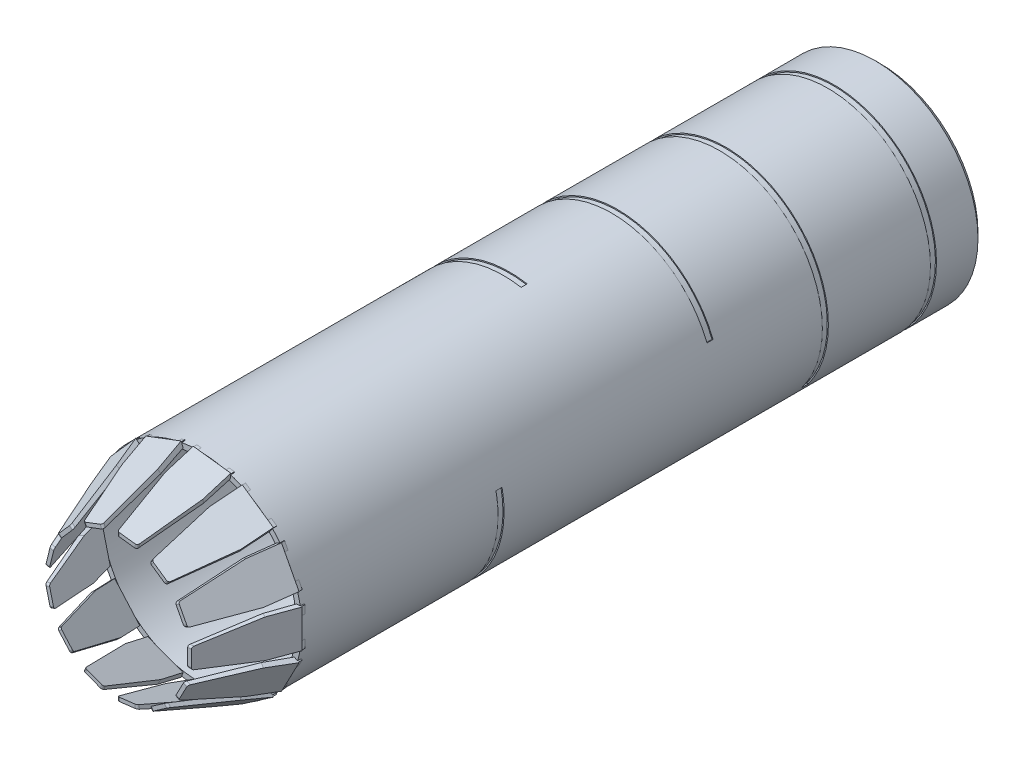
from build123d import *

# Parameters (mm, degrees)
SKETCH1_R                = 48.26
SKETCH1_R_2              = 45.72
BOSS_EXTRUDE1_DEPTH      = 327.66
SKETCH2_W                = 47.008818122
SKETCH2_H                = 2.513618532
BOSS_EXTRUDE2_DEPTH      = 3.175
BOSS_EXTRUDE7_DEPTH      = 2.513618531
SKETCH5_R                = 5.08
CUT_EXTRUDE1_DEPTH       = 2.513618531
FILLET2_R                = 1.016
CHAMFER1_SIZE            = 10
LPATTERN1_COUNT          = 2
LPATTERN1_PITCH          = 90.64
FILLET2_OF_LPATTERN1_R   = 1.016
WRAP1_START              = 29.498597097
WRAP1_DEPTH              = 2.844519113
WRAP1_START_2            = 80.298597097
WRAP1_2_DEPTH            = 2.844519113
WRAP1_START_3            = 131.098597097
WRAP1_3_DEPTH            = 2.844519113
WRAP1_START_4            = 181.898597097
WRAP1_4_DEPTH            = 2.844519113
WRAP1_START_5            = 232.698597097
WRAP1_5_DEPTH            = 2.844519113
BOSS_EXTRUDE13_DEPTH     = 8.89
CUT_EXTRUDE6_DEPTH       = 5.08
FILLET4_R                = 1.016
CIRPATTERN9_COUNT        = 13
FILLET4_OF_CIRPATTERN9_R = 1.016


# Read off the part's stored shape, not the designer's step: Wrap1
with BuildPart() as part:
    # Sketch1 → Boss-Extrude1 (new body)
    with BuildSketch(Plane.XY):
        with Locations(Location((0, 0, 0), (0, 0, 180))):
            Circle(SKETCH1_R)
        with Locations(Location((0, 0, 0), (0, 0, 180))):
            Circle(SKETCH1_R_2, mode=Mode.SUBTRACT)
    extrude(amount=BOSS_EXTRUDE1_DEPTH)



with BuildPart() as body_2:
    # Sketch2 → Boss-Extrude2 (new, symmetric)
    with BuildSketch(Plane(origin=(0, 0, 0), x_dir=(1, 0, 0), z_dir=(0, 1, 0))):
        with Locations((-23.504409061, -159.441756583)):
            Rectangle(SKETCH2_W, SKETCH2_H)
        with Locations((23.504409061, -159.441756583)):
            Rectangle(SKETCH2_W, SKETCH2_H)
    boss_extrude2 = extrude(amount=BOSS_EXTRUDE2_DEPTH, both=True)


with BuildPart() as part_1:
    add(part.part)

    add(body_2.part)  # Boss-Extrude7 merges body 2
    # Sketch3 → Boss-Extrude7 (add)
    with BuildSketch(Plane.XY.offset(160.698565849)):
        with BuildLine():
            Line((-2.46718371, 6.978221854), (-2.46718371, 46.471312428))
            Line((-2.46718371, 46.471312428), (2.886200105, 46.471312428))
            Line((2.886200105, 46.471312428), (2.886200105, 6.815601563))
            ThreePointArc((2.886200105, 6.815601563), (7.401525228, 0), (2.886200105, -6.815601563))
            Line((2.886200105, -6.815601563), (2.886200105, -47.233562192))
            Line((2.886200105, -47.233562192), (-2.464247635, -47.233562192))
            Line((-2.464247635, -47.233562192), (-2.464247635, -6.979259223))
            ThreePointArc((-2.464247635, -6.979259223), (-7.401525065, -0.001556974), (-2.46718371, 6.978221854))
        make_face()
    boss_extrude7 = extrude(amount=-BOSS_EXTRUDE7_DEPTH)

    # Sketch5 → Cut-Extrude1 (cut)
    with BuildSketch(Plane.XY.offset(160.698565849)):
        Circle(SKETCH5_R)
    cut_extrude1 = extrude(amount=-CUT_EXTRUDE1_DEPTH, mode=Mode.SUBTRACT)

    # Fillet2
    fillet2_edges = [part_1.edges().sort_by_distance(p)[0] for p in [
        (-4.955915281, 5.49740661, 160.698565849),
        (5.120548573, -5.34439501, 160.698565849),
        (-4.955915281, 5.49740661, 158.184947318),
        (5.120548573, -5.34439501, 158.184947318),
        (5.120548573, 5.34439501, 158.184947318),
        (5.120548573, 5.34439501, 160.698565849),
        (-4.954758745, -5.498449007, 158.184947318),
        (-4.954758745, -5.498449007, 160.698565849),
        (-5.08, 0, 160.698565849),
        (-5.08, 0, 158.184947318),
    ]]
    fillet(fillet2_edges, radius=FILLET2_R)

    # Chamfer1
    # the kernel refuses this chamfer: 10 mm, written as the material it takes off along each edge
    with BuildSketch(Plane(origin=(0, 0, 0), x_dir=(-1, 0, 0), z_dir=(0, 1, 0))) as chamfer1_piece_1:
        Polygon((48.26 - CHAMFER1_SIZE, 0), (48.26, CHAMFER1_SIZE), (48.26, 0), align=None)
    revolve(axis=Axis((0, 0, 0), (0, 0, 1)), mode=Mode.SUBTRACT)

    # LPattern1: Boss-Extrude2, Boss-Extrude7, Cut-Extrude1 ×2
    with Locations(*[(0, 0, -i * LPATTERN1_PITCH) for i in range(1, LPATTERN1_COUNT)]):
        add(boss_extrude2)
        add(boss_extrude7)
        add(cut_extrude1, mode=Mode.SUBTRACT)

    # Fillet2 of LPattern1
    fillet2_of_lpattern1_edges = [part_1.edges().sort_by_distance(p)[0] for p in [
        (-4.955915281, 5.49740661, 70.058565849),
        (5.120548573, -5.34439501, 70.058565849),
        (-4.955915281, 5.49740661, 67.544947318),
        (5.120548573, -5.34439501, 67.544947318),
        (5.120548573, 5.34439501, 67.544947318),
        (5.120548573, 5.34439501, 70.058565849),
        (-4.954758745, -5.498449007, 67.544947318),
        (-4.954758745, -5.498449007, 70.058565849),
        (-5.08, 0, 70.058565849),
        (-5.08, 0, 67.544947318),
    ]]
    fillet(fillet2_of_lpattern1_edges, radius=FILLET2_OF_LPATTERN1_R)

    # Wrap1 outline → Wrap1 (cut)
    with BuildSketch(Plane.XY.offset(WRAP1_START)):
        with BuildLine():
            Line((-35.732395655, 32.437994709), (-35.356265175, 32.096542133))
            ThreePointArc((-35.356265175, 32.096542133), (-15.484737889, 45.171632652), (8.229263826, 47.037567123))
            ThreePointArc((8.229263826, 47.037567123), (30.145222424, 37.034025828), (44.388487366, 17.604422551))
            ThreePointArc((44.388487366, 17.604422551), (45.765032124, 13.631410002), (46.78674255, 9.552707759))
            ThreePointArc((46.78674255, 9.552707759), (35.566419942, -31.86351011), (-4.372134012, -47.55142425))
            Line((-4.372134012, -47.55142425), (-4.418646076, -48.057290465))
            ThreePointArc((-4.418646076, -48.057290465), (44.976652519, 17.496523316), (-35.732395655, 32.437994709))
        make_face()
    extrude(amount=WRAP1_DEPTH, mode=Mode.SUBTRACT)

    # Wrap1 2 outline → Wrap1 2 (cut)
    with BuildSketch(Plane.XY.offset(WRAP1_START_2)):
        with BuildLine():
            Line((-46.341425462, -13.472189361), (-45.853620984, -13.330376841))
            ThreePointArc((-45.853620984, -13.330376841), (-46.595581473, 10.445347825), (-35.775038833, 31.629102114))
            ThreePointArc((-35.775038833, 31.629102114), (-15.781242938, 45.068901421), (8.229263826, 47.037567123))
            ThreePointArc((8.229263826, 47.037567123), (30.145222424, 37.034025828), (44.388487366, 17.604422551))
            ThreePointArc((44.388487366, 17.604422551), (45.765032124, 13.631410002), (46.78674255, 9.552707759))
            ThreePointArc((46.78674255, 9.552707759), (46.595581473, -10.445347825), (38.231508302, -28.611278842))
            Line((38.231508302, -28.611278842), (38.638226475, -28.915654149))
            ThreePointArc((38.638226475, -28.915654149), (8.629019053, 47.482287542), (-46.341425462, -13.472189361))
        make_face()
    extrude(amount=WRAP1_2_DEPTH, mode=Mode.SUBTRACT)

    # Wrap1 3 outline → Wrap1 3 (cut)
    with BuildSketch(Plane.XY.offset(WRAP1_START_3)):
        with BuildLine():
            Line((44.388487366, 17.604422551), (44.860705317, 17.791703642))
            ThreePointArc((44.860705317, 17.791703642), (-35.944786112, 32.202483621), (-12.772487845, -46.539135727))
            Line((-12.772487845, -46.539135727), (-12.638040604, -46.049250088))
            ThreePointArc((-12.638040604, -46.049250088), (-45.765032125, -13.631410003), (-35.775038833, 31.629102114))
            ThreePointArc((-35.775038833, 31.629102114), (-15.781242938, 45.068901421), (8.229263826, 47.037567123))
            ThreePointArc((8.229263826, 47.037567123), (30.145222424, 37.034025828), (44.388487366, 17.604422551))
        make_face()
    extrude(amount=WRAP1_3_DEPTH, mode=Mode.SUBTRACT)

    # Wrap1 4 outline → Wrap1 4 (cut)
    with BuildSketch(Plane.XY.offset(WRAP1_START_4)):
        with BuildLine():
            Line((8.229263826, 47.037567123), (8.316809186, 47.537966774))
            ThreePointArc((8.316809186, 47.537966774), (-46.251894168, -13.776425002), (32.972651654, -35.239634546))
            Line((32.972651654, -35.239634546), (32.62557111, -34.868691024))
            ThreePointArc((32.62557111, -34.868691024), (-33.286166944, -34.238641828), (-35.775038833, 31.629102114))
            ThreePointArc((-35.775038833, 31.629102114), (-15.781242938, 45.068901421), (8.229263826, 47.037567123))
        make_face()
    extrude(amount=WRAP1_4_DEPTH, mode=Mode.SUBTRACT)

    # Wrap1 5 outline → Wrap1 5 (cut)
    with BuildSketch(Plane.XY.offset(WRAP1_START_5)):
        with BuildLine():
            Line((47.284473854, 9.65433231), (46.78674255, 9.552707759))
            ThreePointArc((46.78674255, 9.552707759), (-12.335161192, -46.131305015), (-35.775038833, 31.629102114))
            Line((-35.775038833, 31.629102114), (-36.155624352, 31.965581923))
            ThreePointArc((-36.155624352, 31.965581923), (-12.46638631, -46.622063579), (47.284473854, 9.65433231))
        make_face()
    extrude(amount=WRAP1_5_DEPTH, mode=Mode.SUBTRACT)

    # Sketch9 → Boss-Extrude13 (add, symmetric)
    with BuildSketch(Plane(origin=(0, 0, 0), x_dir=(1, 0, 0), z_dir=(0, 1, 0))):
        Polygon((48.26, -327.66), (34.392734074, -365.76), (32.641114901, -365.76), (45.72, -327.66), (46.99, -327.66), (46.99, -325.935327225), (47.988199263, -325.935327225), (47.988199263, -327.66), align=None)
    boss_extrude13 = extrude(amount=BOSS_EXTRUDE13_DEPTH, both=True)

    # Sketch13 → Cut-Extrude6 (cut)
    with BuildSketch(Plane(origin=(147.922546507, 0, 53.839403906), x_dir=(0.34202014332566294, 0, -0.9396926207859105), z_dir=(0.9396926207859105, 0, 0.34202014332566294))):
        Polygon((-331.938965141, 4.664453951), (-298.964478316, 9.81413898), (-336.036879845, 10.965245045), (-336.036879845, 4.024475227), align=None)
        Polygon((-336.036879845, -4.024475227), (-336.036879845, -10.965245045), (-298.964478316, -9.81413898), (-331.938965141, -4.664453951), align=None)
    cut_extrude6 = extrude(amount=-CUT_EXTRUDE6_DEPTH, mode=Mode.SUBTRACT)

    # Fillet4
    fillet4_edges = [part_1.edges().sort_by_distance(p)[0] for p in [
        (33.516924488, 4.617673543, 365.76),
        (33.516924488, -4.617673543, 365.76),
    ]]
    fillet(fillet4_edges, radius=FILLET4_R)

    # CirPattern9: Boss-Extrude13, Cut-Extrude6 ×13 about axis
    cirpattern9_axis = Axis((0.209508198, 0, 0), (0, 0, 1))
    add([boss_extrude13.rotate(cirpattern9_axis, i * 360 / CIRPATTERN9_COUNT) for i in range(1, CIRPATTERN9_COUNT)])
    add([cut_extrude6.rotate(cirpattern9_axis, i * 360 / CIRPATTERN9_COUNT) for i in range(1, CIRPATTERN9_COUNT)], mode=Mode.SUBTRACT)

    # Fillet4 of CirPattern9
    fillet4_of_cirpattern9_edges = [part_1.edges().sort_by_distance(p)[0] for p in [
        (27.555820754, 19.567475014, 365.76),
        (31.847700547, 11.389981288, 365.76),
        (15.330006373, 30.034603773, 365.76),
        (22.930548021, 24.788328669, 365.76),
        (-0.359731919, 33.621166764, 365.76),
        (8.808279089, 32.507968685, 365.76),
        (-15.91906416, 29.505525628, 365.76),
        (-7.283864627, 32.780424838, 365.76),
        (-27.783534844, 18.630524151, 365.76),
        (-21.659366934, 25.543280708, 365.76),
        (-33.23513672, 3.487494113, 365.76),
        (-31.024973497, 12.454478798, 365.76),
        (-31.024973497, -12.454478798, 365.76),
        (-33.23513672, -3.487494113, 365.76),
        (-21.659366934, -25.543280708, 365.76),
        (-27.783534844, -18.630524151, 365.76),
        (-7.283864627, -32.780424838, 365.76),
        (-15.91906416, -29.505525628, 365.76),
        (8.808279089, -32.507968685, 365.76),
        (-0.359731919, -33.621166764, 365.76),
        (22.930548021, -24.788328669, 365.76),
        (15.330006373, -30.034603773, 365.76),
        (31.847700547, -11.389981288, 365.76),
        (27.555820754, -19.567475014, 365.76),
    ]]
    fillet(fillet4_of_cirpattern9_edges, radius=FILLET4_OF_CIRPATTERN9_R)


solid = part_1.part
